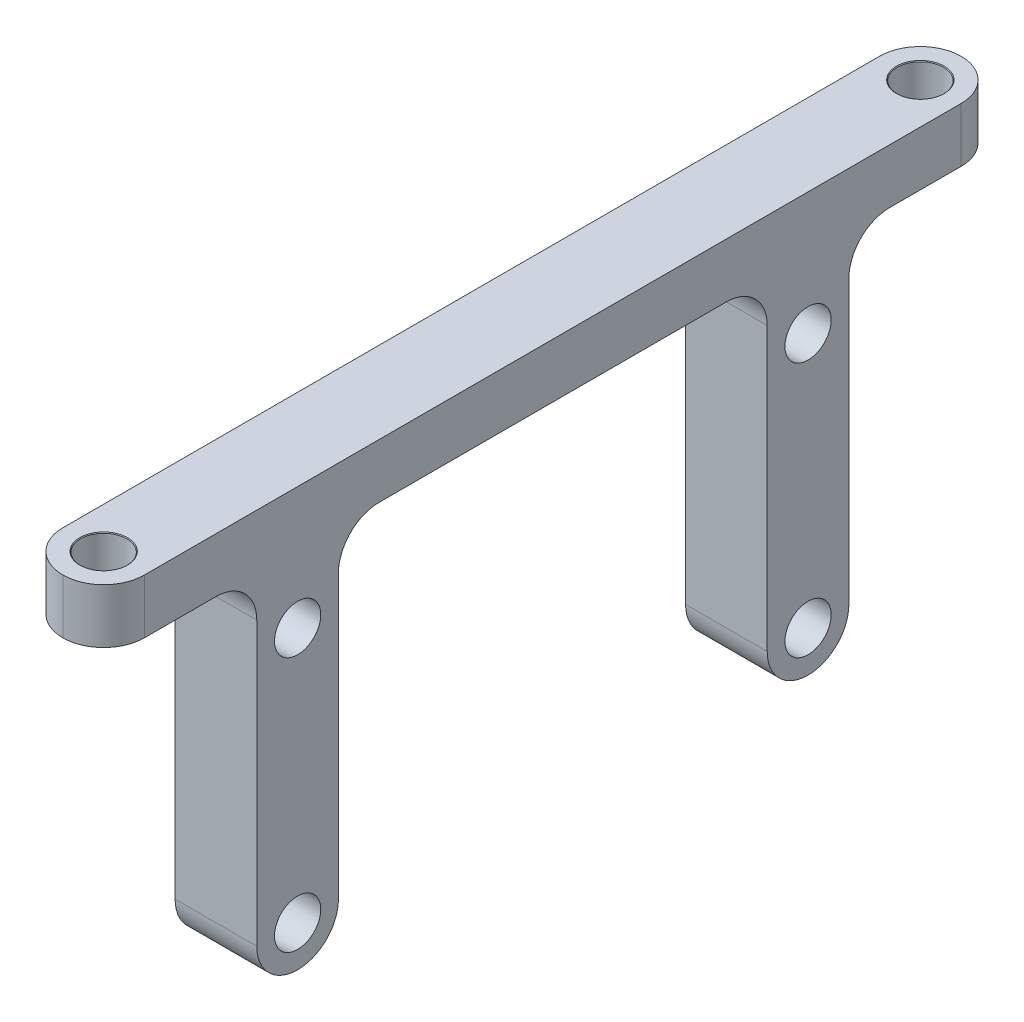
from build123d import *

# Parameters (mm, degrees)
SKETCH1_R                                       = 1.7
BOSS_EXTRUDE1_DEPTH                             = 6
CSK_FOR_M3_FLAT_HEAD_MACHINE_SCREW1_D           = 3.4
CSK_FOR_M3_FLAT_HEAD_MACHINE_SCREW1_DEPTH       = 6
CSK_FOR_M3_FLAT_HEAD_MACHINE_SCREW1_CSINK_D     = 3.5
CSK_FOR_M3_FLAT_HEAD_MACHINE_SCREW1_CSINK_ANGLE = 90
CSK_FOR_M3_FLAT_HEAD_MACHINE_SCREW1_TIP         = 1.021463052
FILLET1_R                                       = 3
FILLET2_R                                       = 3
FILLET3_R                                       = 3


with BuildPart() as part:
    # Sketch1 → Boss-Extrude1 (new body)
    with BuildSketch(Plane(origin=(0, 0, 0), x_dir=(0, 0, -1), z_dir=(1, 0, 0))):
        Polygon((-21.75, -26.75), (-21.75, 0), (-33, 0), (-33, 4), (33, 4), (33, 0), (21.75, 0), (21.75, -26.75), (15.75, -26.75), (15.75, 0), (-15.75, 0), (-15.75, -26.75), align=None)
        with Locations((18.75, -5)):
            Circle(SKETCH1_R, mode=Mode.SUBTRACT)
        with Locations((18.75, -23.75)):
            Circle(SKETCH1_R, mode=Mode.SUBTRACT)
        with Locations(Location((-18.75, -23.75, 0), (0, 0, 180))):
            Circle(SKETCH1_R, mode=Mode.SUBTRACT)
        with Locations(Location((-18.75, -5, 0), (0, 0, 180))):
            Circle(SKETCH1_R, mode=Mode.SUBTRACT)
    extrude(amount=BOSS_EXTRUDE1_DEPTH)

    # CSK for M3 Flat Head Machine Screw1
    with Locations(Plane(origin=(0, 4, 0), x_dir=(1, 0, 0), z_dir=(0, 1, 0))):
        with Locations((3, 30), (3, -30)):
            CounterSinkHole(CSK_FOR_M3_FLAT_HEAD_MACHINE_SCREW1_D / 2, CSK_FOR_M3_FLAT_HEAD_MACHINE_SCREW1_CSINK_D / 2, depth=CSK_FOR_M3_FLAT_HEAD_MACHINE_SCREW1_DEPTH, counter_sink_angle=CSK_FOR_M3_FLAT_HEAD_MACHINE_SCREW1_CSINK_ANGLE)
            with Locations((0, 0, -(CSK_FOR_M3_FLAT_HEAD_MACHINE_SCREW1_DEPTH + CSK_FOR_M3_FLAT_HEAD_MACHINE_SCREW1_TIP / 2))):  # 118° drill point
                Cone(0, CSK_FOR_M3_FLAT_HEAD_MACHINE_SCREW1_D / 2, CSK_FOR_M3_FLAT_HEAD_MACHINE_SCREW1_TIP, mode=Mode.SUBTRACT)

    # Fillet1
    fillet1_edges = [part.edges().sort_by_distance(p)[0] for p in [
        (3, -26.75, -21.75),
        (3, -26.75, -15.75),
        (3, -26.75, 15.75),
        (3, -26.75, 21.75),
    ]]
    fillet(fillet1_edges, radius=FILLET1_R - 0.0001)  # a hair under: the kernel refuses the full size

    # Fillet2
    fillet2_edges = [part.edges().sort_by_distance(p)[0] for p in [
        (3, 0, 21.75),
        (3, 0, -21.75),
        (3, 0, -15.75),
        (3, 0, 15.75),
    ]]
    fillet(fillet2_edges, radius=FILLET2_R)

    # Fillet3
    fillet3_edges = [part.edges().sort_by_distance(p)[0] for p in [
        (6, 2, -33),
        (0, 2, -33),
        (0, 2, 33),
        (6, 2, 33),
    ]]
    fillet(fillet3_edges, radius=FILLET3_R - 0.0001)  # a hair under: the kernel refuses the full size


solid = part.part
